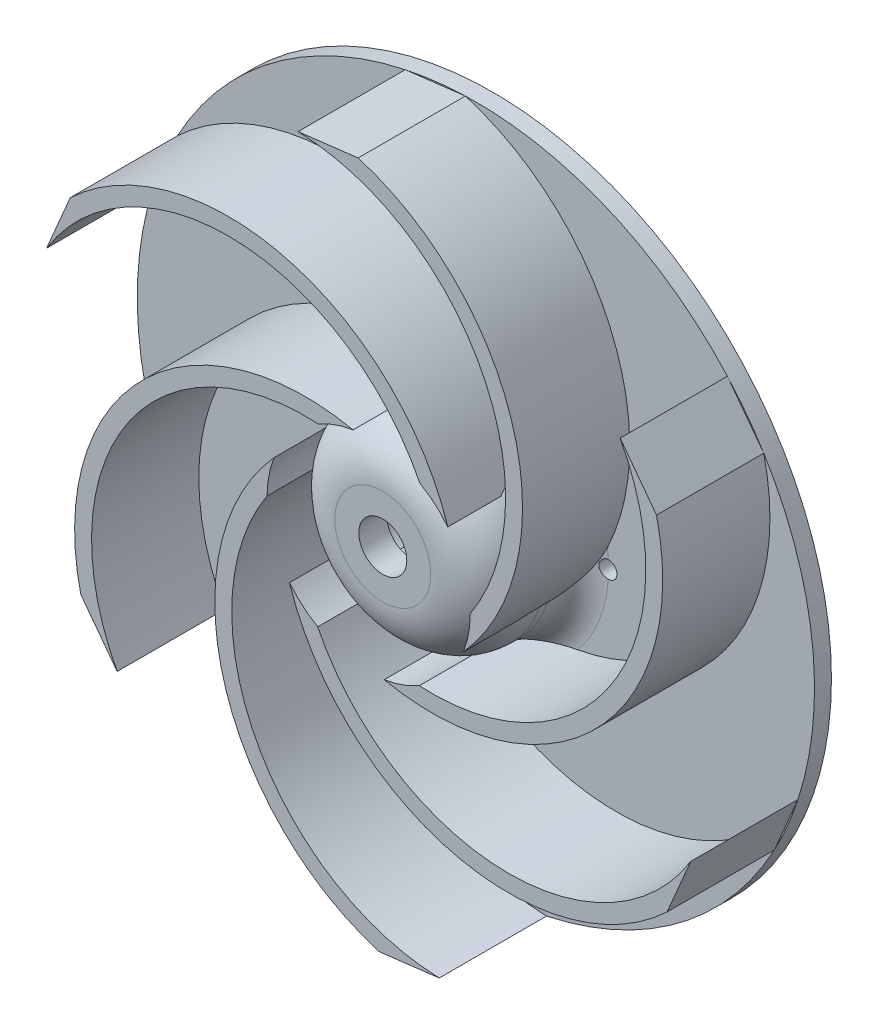
from build123d import *

# Parameters (mm, degrees)
CROQUIS1_R                 = 60
SALIENTE_EXTRUIR1_DEPTH    = 3
CROQUIS2_R                 = 14
CORTAR_EXTRUIR2_DEPTH      = 1.5
CROQUIS3_R                 = 1.5
CORTAR_EXTRUIR3_DEPTH      = 3
CORTAR_EXTRUIR4_DEPTH      = 40
CORTAR_EXTRUIR4_DEPTH_BACK = 43
CROQUIS4_R                 = 4.25
CROQUIS6_R                 = 18.5
SALIENTE_EXTRUIR2_DEPTH    = 16.5
CORTAR_EXTRUIR5_DEPTH      = 13
CROQUIS7_R                 = 4.25
CORTAR_EXTRUIR6_DEPTH      = 27
REDONDEO2_R                = 5
REDONDEO3_R                = 10
SALIENTE_EXTRUIR3_DEPTH    = 19


with BuildPart() as part:
    # Croquis1 → Saliente-Extruir1 (new body)
    with BuildSketch(Plane.XY):
        Circle(CROQUIS1_R)
    extrude(amount=SALIENTE_EXTRUIR1_DEPTH)

    # Croquis2 → Cortar-Extruir2 (cut)
    with BuildSketch(Plane.XY):
        Circle(CROQUIS2_R)
    extrude(amount=CORTAR_EXTRUIR2_DEPTH, mode=Mode.SUBTRACT)

    # Croquis3 → Cortar-Extruir3 (cut)
    with BuildSketch(Plane.XY):
        with Locations((-23.5, 0)):
            Circle(CROQUIS3_R)
        with Locations((23.5, 0)):
            Circle(CROQUIS3_R)
    extrude(amount=CORTAR_EXTRUIR3_DEPTH, mode=Mode.SUBTRACT)

    # Croquis4 → Cortar-Extruir4 (cut, two sides: drawn at the far end of the back side and taken through both)
    with BuildSketch(Plane.XY.offset(-CORTAR_EXTRUIR4_DEPTH_BACK)):
        with Locations(Location((0, 0, 0), (0, 0, 180))):
            Circle(CROQUIS4_R)
    extrude(amount=CORTAR_EXTRUIR4_DEPTH + CORTAR_EXTRUIR4_DEPTH_BACK, mode=Mode.SUBTRACT)

    # Croquis6 → Saliente-Extruir2 (add)
    with BuildSketch(Plane.XY.offset(3)):
        Circle(CROQUIS6_R)
    extrude(amount=SALIENTE_EXTRUIR2_DEPTH)

    # Croquis5 → Cortar-Extruir5 (cut)
    with BuildSketch(Plane(origin=(0, 0, 1.5), x_dir=(-1, 0, 0), z_dir=(0, 0, -1))):
        with BuildLine():
            Line((3.5, -5.45), (-3.5, -5.45))
            ThreePointArc((-3.5, -5.45), (-6.4, 0), (-3.5, 5.45))
            Line((-3.5, 5.45), (3.5, 5.45))
            ThreePointArc((3.5, 5.45), (6.425445273, 0), (3.5, -5.45))
        make_face()
    extrude(amount=-CORTAR_EXTRUIR5_DEPTH, mode=Mode.SUBTRACT)

    # Croquis7 → Cortar-Extruir6 (cut)
    with BuildSketch(Plane.XY):
        with Locations(Location((0, 0, 0), (0, 0, 180))):
            Circle(CROQUIS7_R)
    extrude(amount=CORTAR_EXTRUIR6_DEPTH, mode=Mode.SUBTRACT)

    # Redondeo2
    # the kernel refuses this fillet: 5 mm, written as the material it adds along each edge
    with BuildSketch(Plane(origin=(0, 0, 3), x_dir=(1, 0, 0), z_dir=(0, -1, 0))) as redondeo2_piece_1_section:
        with BuildLine():
            CenterArc((18.5 + REDONDEO2_R, REDONDEO2_R), REDONDEO2_R, 180, 90)
            Line((18.5, REDONDEO2_R), (18.5, 0))
            Line((18.5, 0), (18.5 + REDONDEO2_R, 0))
        make_face()
    redondeo2_piece_1 = revolve(axis=Axis((0, 0, 3), (0, 0, 1)), mode=Mode.PRIVATE)
    redondeo2_piece_1 = redondeo2_piece_1 - Plane(origin=(-23.5, 0, 4.39922922), x_dir=(1, 0, 0), z_dir=(0, 0, -1)) * Cylinder(1.5, 94, mode=Mode.PRIVATE)
    redondeo2_piece_1 = redondeo2_piece_1 - Plane(origin=(23.5, 0, 4.39922922), x_dir=(1, 0, 0), z_dir=(0, 0, -1)) * Cylinder(1.5, 94, mode=Mode.PRIVATE)
    add(redondeo2_piece_1)

    # Redondeo3
    redondeo3_edges = [part.edges().sort_by_distance(p)[0] for p in [
        (-18.5, 0, 19.5),
    ]]
    fillet(redondeo3_edges, radius=REDONDEO3_R)

    # Croquis8 → Saliente-Extruir3 (add)
    with BuildSketch(Plane.XY.offset(3)):
        with BuildLine():
            Line((-44.559821359, -40.17987457), (-51.005642028, -31.597855644))
            ThreePointArc((-51.005642028, -31.597855644), (-40.464194406, 6.3663011), (-2.755472755, 17.787843318))
            ThreePointArc((-2.755472755, 17.787843318), (-5.961167432, 16.984242192), (-8.965907234, 15.60809109))
            ThreePointArc((-8.965907234, 15.60809109), (-43.156439181, -1.826440679), (-44.559821359, -40.17987457))
        make_face()
        with BuildLine():
            Line((-57.076702778, 18.5), (-52.867366707, 28.373253911))
            ThreePointArc((-52.867366707, 28.373253911), (-14.718718723, 38.22617085), (14.026987814, 11.280231064))
            ThreePointArc((14.026987814, 11.280231064), (11.728201487, 13.654643529), (9.034049772, 15.568748978))
            ThreePointArc((9.034049772, 15.568748978), (-23.159963617, 36.461352328), (-57.076702778, 18.5))
        make_face()
        with BuildLine():
            Line((-12.516881419, 58.67987457), (-1.861724679, 59.971109555))
            ThreePointArc((-1.861724679, 59.971109555), (25.745475684, 31.85986975), (16.782460569, -6.507612254))
            ThreePointArc((16.782460569, -6.507612254), (17.689368919, -3.329598664), (17.999957005, -0.039342113))
            ThreePointArc((17.999957005, -0.039342113), (19.996475564, 38.287793007), (-12.516881419, 58.67987457))
        make_face()
        with BuildLine():
            Line((44.559821359, 40.17987457), (51.005642028, 31.597855644))
            ThreePointArc((51.005642028, 31.597855644), (40.464194406, -6.3663011), (2.755472755, -17.787843318))
            ThreePointArc((2.755472755, -17.787843318), (5.961167432, -16.984242192), (8.965907234, -15.60809109))
            ThreePointArc((8.965907234, -15.60809109), (43.156439181, 1.826440679), (44.559821359, 40.17987457))
        make_face()
        with BuildLine():
            Line((57.076702778, -18.5), (52.867366707, -28.373253911))
            ThreePointArc((52.867366707, -28.373253911), (14.718718723, -38.22617085), (-14.026987814, -11.280231064))
            ThreePointArc((-14.026987814, -11.280231064), (-11.728201487, -13.654643529), (-9.034049772, -15.568748978))
            ThreePointArc((-9.034049772, -15.568748978), (23.159963617, -36.461352328), (57.076702778, -18.5))
        make_face()
        with BuildLine():
            Line((12.516881419, -58.67987457), (1.861724679, -59.971109555))
            ThreePointArc((1.861724679, -59.971109555), (-25.745475684, -31.85986975), (-16.782460569, 6.507612254))
            ThreePointArc((-16.782460569, 6.507612254), (-17.689368919, 3.329598664), (-17.999957005, 0.039342113))
            ThreePointArc((-17.999957005, 0.039342113), (-19.996475564, -38.287793007), (12.516881419, -58.67987457))
        make_face()
    extrude(amount=SALIENTE_EXTRUIR3_DEPTH)


solid = part.part
